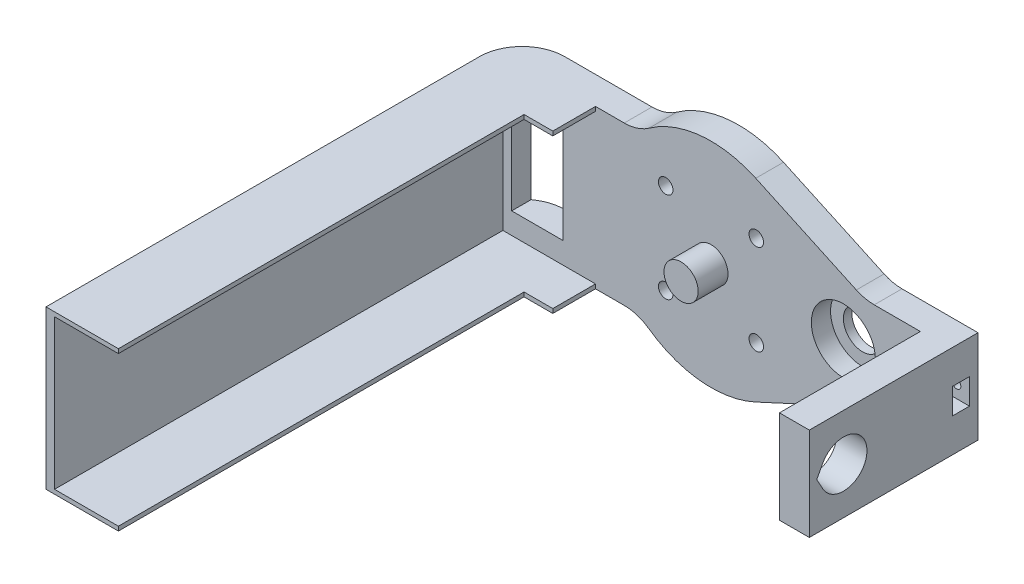
from build123d import *

# Parameters (mm, degrees)
BOSS_EXTRUDE1_DEPTH  = 4.5
SKETCH2_R            = 7.5
CUT_EXTRUDE1_DEPTH   = 50.942466899
SKETCH3_R            = 4
BOSS_EXTRUDE2_DEPTH  = 7
BOSS_EXTRUDE3_DEPTH  = 4.5
FILLET1_R            = 10
CUT_EXTRUDE4_DEPTH   = 62.754464971
SKETCH9_R            = 1
CUT_EXTRUDE5_DEPTH   = 62.182594482
SKETCH10_R           = 1.7
CUT_EXTRUDE6_DEPTH   = 2.4
CUT_EXTRUDE7_DEPTH   = 4.5
FILLET2_R            = 10
CUT_EXTRUDE8_DEPTH   = 51.658168147
SKETCH23_R           = 1
SKETCH23_R_2         = 4.5
BOSS_EXTRUDE6_DEPTH  = 2
BOSS_EXTRUDE7_START  = -6.5
BOSS_EXTRUDE7_DEPTH  = 6.5
SKETCH26_W           = 9
SKETCH26_H           = 21.787737724
BOSS_EXTRUDE8_DEPTH  = 33
CUT_EXTRUDE9_REACH   = 94.723
SKETCH27_R           = 5
BOSS_EXTRUDE9_DEPTH  = 6.5
BOSS_EXTRUDE10_DEPTH = 105
FILLET3_R            = 10
FILLET4_R            = 10
CUT_EXTRUDE10_DEPTH  = 9
SKETCH31_W           = 12
SKETCH31_H           = 25
CUT_EXTRUDE11_DEPTH  = 122.612556686
BOSS_EXTRUDE11_DEPTH = 10
CUT_EXTRUDE12_REACH  = 141.704
SKETCH33_W           = 10
SKETCH33_H           = 33
CUT_EXTRUDE13_REACH  = 155.593
SKETCH34_W           = 105
SKETCH34_H           = 35
CUT_EXTRUDE14_REACH  = 156.964
SKETCH35_R           = 5.5
CUT_EXTRUDE15_REACH  = 156.964
SKETCH37_W           = 2
SKETCH37_H           = 21.787737724
CUT_EXTRUDE16_DEPTH  = 33
SKETCH38_W           = 4
SKETCH38_H           = 6
CUT_EXTRUDE17_DEPTH  = 6
SKETCH39_R           = 1
CUT_EXTRUDE18_DEPTH  = 6


with BuildPart() as part:
    # Sketch1 → Boss-Extrude1 (new body)
    with BuildSketch(Plane.XY):
        with BuildLine():
            Line((10.483870968, 22.695560128), (36.032258065, 10.893868862))
            ThreePointArc((36.032258065, 10.893868862), (43, 0), (36.032258065, -10.893868862))
            Line((36.032258065, -10.893868862), (10.483870968, -22.695560128))
            ThreePointArc((10.483870968, -22.695560128), (-25, 0), (10.483870968, 22.695560128))
        make_face()
    extrude(amount=BOSS_EXTRUDE1_DEPTH)

    # Sketch2 → Cut-Extrude1 (cut, through all)
    with BuildSketch(Plane.XY.offset(4.5)):
        with Locations((31, 0)):
            Circle(SKETCH2_R)
    extrude(amount=-CUT_EXTRUDE1_DEPTH, mode=Mode.SUBTRACT)

    # Sketch3 → Boss-Extrude2 (add)
    with BuildSketch(Plane.XY.offset(4.5)):
        Circle(SKETCH3_R)
    extrude(amount=BOSS_EXTRUDE2_DEPTH)

    # Sketch4 → Boss-Extrude3 (add)
    with BuildSketch(Plane(origin=(0, 0, 0), x_dir=(-1, 0, 0), z_dir=(0, 0, -1))):
        with BuildLine():
            Line((-36.032258065, 10.893868862), (-56.032258065, 10.893868862))
            Line((-56.032258065, 10.893868862), (-56.032258065, -10.893868862))
            Line((-56.032258065, -10.893868862), (-36.032258065, -10.893868862))
            ThreePointArc((-36.032258065, -10.893868862), (-43, 0), (-36.032258065, 10.893868862))
        make_face()
        with BuildLine():
            Line((22.501635968, 10.893868862), (42.501635968, 10.893868862))
            Line((42.501635968, 10.893868862), (42.501635968, -10.893868862))
            Line((42.501635968, -10.893868862), (22.501635968, -10.893868862))
            ThreePointArc((22.501635968, -10.893868862), (25, 0), (22.501635968, 10.893868862))
        make_face()
    extrude(amount=-BOSS_EXTRUDE3_DEPTH)

    # Fillet1
    fillet1_edges = [part.edges().sort_by_distance(p)[0] for p in [
        (56.032258065, 10.893868862, 2.25),
        (56.032258065, -10.893868862, 2.25),
        (-42.501635968, -10.893868862, 2.25),
        (-42.501635968, 10.893868862, 2.25),
    ]]
    fillet(fillet1_edges, radius=FILLET1_R)

    # Sketch8 → Cut-Extrude4 (cut, through all)
    with BuildSketch(Plane.XY.offset(4.5)):
        with BuildLine():
            Line((56.032258065, 0.893868862), (56.032258065, -0.893868862))
            ThreePointArc((56.032258065, -0.893868862), (55.873267798, -2.669967796), (55.401352579, -4.389590243))
            Line((55.401352579, -4.389590243), (55.401352579, 4.389590243))
            ThreePointArc((55.401352579, 4.389590243), (55.873267798, 2.669967796), (56.032258065, 0.893868862))
        make_face()
        with BuildLine():
            Line((-42.501635968, -0.893868862), (-42.501635968, 0.893868862))
            ThreePointArc((-42.501635968, 0.893868862), (-42.342645701, 2.669967796), (-41.870730482, 4.389590243))
            Line((-41.870730482, 4.389590243), (-41.870730482, -4.389590243))
            ThreePointArc((-41.870730482, -4.389590243), (-42.342645701, -2.669967796), (-42.501635968, -0.893868862))
        make_face()
    extrude(amount=-CUT_EXTRUDE4_DEPTH, mode=Mode.SUBTRACT)

    # Sketch9 → Cut-Extrude5 (cut, through all)
    with BuildSketch(Plane.XY.offset(4.5)):
        with Locations((-10.606601718, 10.606601718)):
            Circle(SKETCH9_R)
        with Locations((10.606601718, 10.606601718)):
            Circle(SKETCH9_R)
        with Locations((10.606601718, -10.606601718)):
            Circle(SKETCH9_R)
        with Locations((-10.606601718, -10.606601718)):
            Circle(SKETCH9_R)
    extrude(amount=-CUT_EXTRUDE5_DEPTH, mode=Mode.SUBTRACT)

    # Sketch10 → Cut-Extrude6 (cut)
    with BuildSketch(Plane.XY.offset(4.5)):
        with Locations((-10.606601718, 10.606601718)):
            Circle(SKETCH10_R)
        with Locations((10.606601718, 10.606601718)):
            Circle(SKETCH10_R)
        with Locations((10.606601718, -10.606601718)):
            Circle(SKETCH10_R)
        with Locations((-10.606601718, -10.606601718)):
            Circle(SKETCH10_R)
    extrude(amount=-CUT_EXTRUDE6_DEPTH, mode=Mode.SUBTRACT)

    # Sketch11 → Cut-Extrude7 (cut)
    with BuildSketch(Plane(origin=(0, 0, 0), x_dir=(-1, 0, 0), z_dir=(0, 0, -1))):
        with BuildLine():
            Line((-40.960235838, 14.646128502), (-73.67178465, 18.9155259))
            Line((-73.67178465, 18.9155259), (-68.640309048, -15.675868866))
            Line((-68.640309048, -15.675868866), (-41.444996676, -13.212200821))
            ThreePointArc((-41.444996676, -13.212200821), (-43.493415761, 0.756825882), (-40.960235838, 14.646128502))
        make_face()
    extrude(amount=-CUT_EXTRUDE7_DEPTH, mode=Mode.SUBTRACT)

    # Fillet2
    # the kernel refuses this fillet: 10 mm, written as the material it takes off along each edge
    with BuildSketch(Plane(origin=(42.113817462, -10.893868862, 28.001897109), x_dir=(0.1443560651040101, 0.9895258088941827, 0), z_dir=(0, 0, -1))) as fillet2_piece_1:
        with BuildLine():
            CenterArc((8.32021185, -9.941449502), FILLET2_R, 83.796810377, 73.10182949)
            Line((-0.877909984, -6.017859982), (-1.061872421, -5.939388192))
            ThreePointArc((-1.061872421, -5.939388192), (-0.636860154, -2.980058778), (-0.197905162, 0.028871213))
            Line((-0.197905162, 0.028871213), (-0.02161094, 0.19882899))
            ThreePointArc((-0.02161094, 0.19882899), (4.700379422, 0.454694668), (9.422369784, 0.19882899))
            Line((9.422369784, 0.19882899), (9.400758844, 0))
        make_face()
    extrude(amount=51.503794219, mode=Mode.SUBTRACT)
    with BuildSketch(Plane(origin=(42.113817462, 10.893868862, 28.001897109), x_dir=(-1, 0, 0), z_dir=(0, 0, -1))) as fillet2_piece_2:
        with BuildLine():
            CenterArc((8.636247816, -9.668172893), FILLET2_R, 104.801368002, 73.10182949)
            Line((-1.357056556, -9.302293499), (-1.556922643, -9.294975911))
            ThreePointArc((-1.556922643, -9.294975911), (-1.128460387, -4.585508816), (-0.193626747, 0.050086753))
            Line((-0.193626747, 0.050086753), (0, 0.2))
            ThreePointArc((0, 0.2), (3.040779699, 0.2), (6.030465629, 0.193363458))
            Line((6.030465629, 0.193363458), (6.081559398, 0))
        make_face()
    extrude(amount=51.503794219, mode=Mode.SUBTRACT)

    # Sketch12 → Cut-Extrude8 (cut, through all)
    with BuildSketch(Plane.XY.offset(4.5)):
        with BuildLine():
            Line((-22.501635968, 10.893868862), (-42.592674389, 14.819498464))
            Line((-42.592674389, 14.819498464), (-48.148078041, -13.612584929))
            Line((-48.148078041, -13.612584929), (-27.427309778, -14.315310761))
            Line((-27.427309778, -14.315310761), (-22.501635968, -10.893868862))
            ThreePointArc((-22.501635968, -10.893868862), (-25, 0), (-22.501635968, 10.893868862))
        make_face()
    extrude(amount=-CUT_EXTRUDE8_DEPTH, mode=Mode.SUBTRACT)

    # Sketch23 → Boss-Extrude6 (add)
    with BuildSketch(Plane(origin=(0, 0, 0), x_dir=(-1, 0, 0), z_dir=(0, 0, -1))):
        with BuildLine():
            Line((-36.032258065, -10.893868862), (-10.483870968, -22.695560128))
            ThreePointArc((-10.483870968, -22.695560128), (25, 0), (-10.483870968, 22.695560128))
            Line((-10.483870968, 22.695560128), (-36.032258065, 10.893868862))
            ThreePointArc((-36.032258065, 10.893868862), (-41.287575846, 7.470998455), (-43.470874018, 1.591575362))
            ThreePointArc((-43.470874018, 1.591575362), (-43.5, 0), (-43.470874018, -1.591575362))
            ThreePointArc((-43.470874018, -1.591575362), (-41.287575846, -7.470998455), (-36.032258065, -10.893868862))
        make_face()
        with Locations(Location((-10.606601718, -10.606601718, 0), (0, 0, 180))):
            Circle(SKETCH23_R, mode=Mode.SUBTRACT)
        with Locations(Location((10.606601718, -10.606601718, 0), (0, 0, 180))):
            Circle(SKETCH23_R, mode=Mode.SUBTRACT)
        with Locations(Location((10.606601718, 10.606601718, 0), (0, 0, 180))):
            Circle(SKETCH23_R, mode=Mode.SUBTRACT)
        with Locations(Location((-10.606601718, 10.606601718, 0), (0, 0, 180))):
            Circle(SKETCH23_R, mode=Mode.SUBTRACT)
        with Locations((-31, 0)):
            Circle(SKETCH23_R_2, mode=Mode.SUBTRACT)
    extrude(amount=BOSS_EXTRUDE6_DEPTH)

    # Sketch25 → Boss-Extrude7 (add)
    with BuildSketch(Plane(origin=(0, 0, -2), x_dir=(-1, 0, 0), z_dir=(0, 0, -1)).offset(BOSS_EXTRUDE7_START)):
        with BuildLine():
            Line((-36.032258065, 10.893868862), (-56.032258065, 10.893868862))
            Line((-56.032258065, 10.893868862), (-56.032258065, -10.893868862))
            Line((-56.032258065, -10.893868862), (-36.032258065, -10.893868862))
            ThreePointArc((-36.032258065, -10.893868862), (-41.287575846, -7.470998455), (-43.470874018, -1.591575362))
            ThreePointArc((-43.470874018, -1.591575362), (-43.5, 0), (-43.470874018, 1.591575362))
            ThreePointArc((-43.470874018, 1.591575362), (-41.287575846, 7.470998455), (-36.032258065, 10.893868862))
        make_face()
    extrude(amount=BOSS_EXTRUDE7_DEPTH)

    # Sketch26 → Boss-Extrude8 (add)
    with BuildSketch(Plane.XY.offset(4.5)):
        with Locations((51.532258065, 0)):
            Rectangle(SKETCH26_W, SKETCH26_H)
    extrude(amount=BOSS_EXTRUDE8_DEPTH)

    # Sketch27 → Cut-Extrude9 (cut, up to next)
    with BuildSketch(Plane(origin=(56.032258065, 0, 0), x_dir=(0, 0, -1), z_dir=(1, 0, 0)), mode=Mode.PRIVATE) as cut_extrude9_sk1:
        with Locations((-29.5, 0)):
            Circle(SKETCH27_R)
    cut_extrude9_tool1 = extrude(cut_extrude9_sk1.sketch, amount=-CUT_EXTRUDE9_REACH, mode=Mode.PRIVATE) & part.part
    add(cut_extrude9_tool1.solids().sort_by_distance((56.032258, 0, 29.5))[0], mode=Mode.SUBTRACT)

    # Sketch28 → Boss-Extrude9 (add)
    with BuildSketch(Plane(origin=(0, 0, -2), x_dir=(-1, 0, 0), z_dir=(0, 0, -1))):
        with BuildLine():
            Line((16.815171721, 18.5), (50.732139714, 18.5))
            Line((50.732139714, 18.5), (50.732139714, -18.5))
            Line((50.732139714, -18.5), (16.815171721, -18.5))
            ThreePointArc((16.815171721, -18.5), (25, 0), (16.815171721, 18.5))
        make_face()
    extrude(amount=-BOSS_EXTRUDE9_DEPTH)

    # Sketch29 → Boss-Extrude10 (add)
    with BuildSketch(Plane.XY.offset(4.5)):
        Polygon((-50.732139714, 18.5), (-33.773655718, 18.5), (-33.773655718, 16.5), (-48.732139714, 16.5), (-48.732139714, -16.5), (-33.773655718, -16.5), (-33.773655718, -18.5), (-50.732139714, -18.5), align=None)
    extrude(amount=BOSS_EXTRUDE10_DEPTH)

    # Fillet3
    fillet3_edges = [part.edges().sort_by_distance(p)[0] for p in [
        (-50.732139714, 0, -2),
    ]]
    fillet(fillet3_edges, radius=FILLET3_R)

    # Fillet4
    fillet4_edges = [part.edges().sort_by_distance(p)[0] for p in [
        (-16.815171721, 18.5, 1.25),
        (-16.815171721, -18.5, 1.25),
        (36.032258065, 10.893868862, 1.25),
        (36.032258065, -10.893868862, 1.25),
    ]]
    fillet(fillet4_edges, radius=FILLET4_R)

    # Sketch30 → Cut-Extrude10 (cut)
    with BuildSketch(Plane(origin=(56.032258065, 0, 0), x_dir=(0, 0, -1), z_dir=(1, 0, 0))):
        with BuildLine():
            Line((-34.192833193, 1.725490257), (-34.827272241, 0))
            Line((-34.827272241, 0), (-34.192833193, -1.725490257))
            ThreePointArc((-34.192833193, -1.725490257), (-34.5, 0), (-34.192833193, 1.725490257))
        make_face()
    extrude(amount=-CUT_EXTRUDE10_DEPTH, mode=Mode.SUBTRACT)

    # Sketch31 → Cut-Extrude11 (cut, through all)
    with BuildSketch(Plane.XY.offset(4.5)):
        with Locations((-40.670586902, 0)):
            Rectangle(SKETCH31_W, SKETCH31_H)
    extrude(amount=-CUT_EXTRUDE11_DEPTH, mode=Mode.SUBTRACT)

    # Sketch32 → Boss-Extrude11 (add)
    with BuildSketch(Plane.XY.offset(4.5)):
        Polygon((-33.773655718, 18.5), (-33.773655718, 16.5), (-27.732139714, 16.5), (-27.732139714, -16.5), (-33.773655718, -16.5), (-33.773655718, -18.5), (-27.044952686, -18.5), (-27.044952686, 18.5), align=None)
    extrude(amount=BOSS_EXTRUDE11_DEPTH)

    # Sketch33 → Cut-Extrude12 (cut, up to next)
    with BuildSketch(Plane(origin=(-27.044952686, 0, 0), x_dir=(0, 0, -1), z_dir=(1, 0, 0)), mode=Mode.PRIVATE) as cut_extrude12_sk1:
        with Locations((-9.5, 0)):
            Rectangle(SKETCH33_W, SKETCH33_H)
    cut_extrude12_tool1 = extrude(cut_extrude12_sk1.sketch, amount=-CUT_EXTRUDE12_REACH, mode=Mode.PRIVATE) & part.part
    add(cut_extrude12_tool1.solids().sort_by_distance((-27.044953, 0, 9.5))[0], mode=Mode.SUBTRACT)

    # Cut-Extrude13: up to this face of the body (flat: up to its plane)
    cut_extrude13_end = Plane(part.part.faces().sort_by_distance((-27.044952686, -17.5, 9.5))[0])
    # Sketch34 → Cut-Extrude13 (cut, up to the picked face)
    with BuildSketch(Plane(origin=(-48.732139714, 0, 0), x_dir=(0, 0, -1), z_dir=(1, 0, 0)), mode=Mode.PRIVATE) as cut_extrude13_sk1:
        with Locations((-57, 0)):
            Rectangle(SKETCH34_W, SKETCH34_H)
    cut_extrude13_tool1 = split(extrude(cut_extrude13_sk1.sketch, amount=CUT_EXTRUDE13_REACH, mode=Mode.PRIVATE), bisect_by=cut_extrude13_end, keep=Keep.BOTH, mode=Mode.PRIVATE)
    add(cut_extrude13_tool1.solids().sort_by(Axis((-48.73214, 0, 57), (1, 0, 0)))[0], mode=Mode.SUBTRACT)

    # Sketch35 → Cut-Extrude14 (cut, up to next)
    with BuildSketch(Plane(origin=(56.032258065, 0, 0), x_dir=(0, 0, -1), z_dir=(1, 0, 0)), mode=Mode.PRIVATE) as cut_extrude14_sk1:
        with Locations((-29.5, 0)):
            Circle(SKETCH35_R)
    cut_extrude14_tool1 = extrude(cut_extrude14_sk1.sketch, amount=-CUT_EXTRUDE14_REACH, mode=Mode.PRIVATE) & part.part
    add(cut_extrude14_tool1.solids().sort_by_distance((56.032258, 0, 29.5))[0], mode=Mode.SUBTRACT)

    # Sketch36 → Cut-Extrude15 (cut, up to next)
    with BuildSketch(Plane(origin=(56.032258065, 0, 0), x_dir=(0, 0, -1), z_dir=(1, 0, 0)), mode=Mode.PRIVATE) as cut_extrude15_sk1:
        with BuildLine():
            Line((-34.328425651, 2.633686719), (-35.764982043, 0))
            Line((-35.764982043, 0), (-34.328425651, -2.633686719))
            ThreePointArc((-34.328425651, -2.633686719), (-35, 0), (-34.328425651, 2.633686719))
        make_face()
    cut_extrude15_tool1 = extrude(cut_extrude15_sk1.sketch, amount=-CUT_EXTRUDE15_REACH, mode=Mode.PRIVATE) & part.part
    add(cut_extrude15_tool1.solids().sort_by_distance((56.032258, 0, 35.16481))[0], mode=Mode.SUBTRACT)

    # Sketch37 → Cut-Extrude16 (cut)
    with BuildSketch(Plane.XY.offset(37.5)):
        with Locations((48.032258065, 0)):
            Rectangle(SKETCH37_W, SKETCH37_H)
    extrude(amount=-CUT_EXTRUDE16_DEPTH, mode=Mode.SUBTRACT)

    # Sketch38 → Cut-Extrude17 (cut)
    with BuildSketch(Plane(origin=(56.032258065, 0, 0), x_dir=(0, 0, -1), z_dir=(1, 0, 0))):
        with Locations((-2, 0)):
            Rectangle(SKETCH38_W, SKETCH38_H)
    extrude(amount=-CUT_EXTRUDE17_DEPTH, mode=Mode.SUBTRACT)

    # Sketch39 → Cut-Extrude18 (cut)
    with BuildSketch(Plane(origin=(0, 0, -2), x_dir=(-1, 0, 0), z_dir=(0, 0, -1))):
        with Locations((-53.016129032, 0)):
            Circle(SKETCH39_R)
    extrude(amount=-CUT_EXTRUDE18_DEPTH, mode=Mode.SUBTRACT)


solid = part.part
